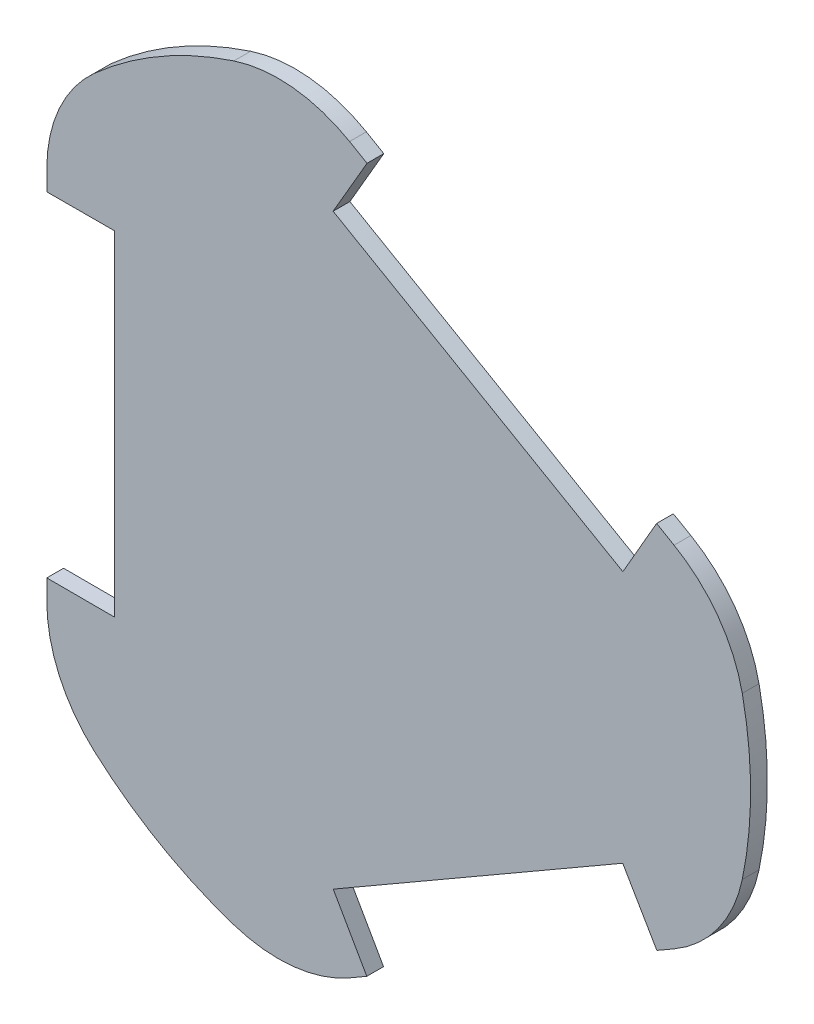
from build123d import *

# Parameters (mm, degrees)
SKETCH1_R           = 5
BOSS_EXTRUDE1_DEPTH = 2
SKETCH2_R           = 6
BOSS_EXTRUDE2_DEPTH = 2
SKETCH4_R           = 4
BOSS_EXTRUDE3_DEPTH = 1


with BuildPart() as part:
    # Sketch1 → Boss-Extrude1 (new body)
    with BuildSketch(Plane.XY):
        with BuildLine():
            Line((26.754759572, 15.066584336), (-7.828159274, 35.03304384))
            Line((-7.828159274, 35.03304384), (-3.776725793, 42.017662227))
            Line((-3.776725793, 42.017662227), (-5.864916731, 43.223279828))
            ThreePointArc((-5.864916731, 43.223279828), (-10.564626295, 45.070633496), (-15.599655414, 45.455948092))
            ThreePointArc((-15.599655414, 45.455948092), (-17.660328687, 45.178385552), (-19.671702879, 44.651328476))
            ThreePointArc((-19.671702879, 44.651328476), (-28.5, 40.703193978), (-36.333333333, 35.031731647))
            ThreePointArc((-36.333333333, 35.031731647), (-37.795465247, 33.553359039), (-39.066178094, 31.907544906))
            ThreePointArc((-39.066178094, 31.907544906), (-41.250000425, 27.354424482), (-42, 22.360679775))
            Line((-42, 22.360679775), (-42, 19.950798463))
            Line((-42, 19.950798463), (-33.9254247, 19.967136312))
            Line((-33.9254247, 19.967136312), (-33.9254247, -19.965779701))
            Line((-33.9254247, -19.965779701), (-42, -19.949444575))
            Line((-42, -19.949444575), (-42, -22.360679775))
            ThreePointArc((-42, -22.360679775), (-41.250000425, -27.354424482), (-39.066178094, -31.907544906))
            ThreePointArc((-39.066178094, -31.907544906), (-37.795465247, -33.553359039), (-36.333333333, -35.031731647))
            ThreePointArc((-36.333333333, -35.031731647), (-28.5, -40.703193978), (-19.671702879, -44.651328476))
            ThreePointArc((-19.671702879, -44.651328476), (-17.660328687, -45.178385552), (-15.599655414, -45.455948092))
            ThreePointArc((-15.599655414, -45.455948092), (-10.564626295, -45.070633496), (-5.864916731, -43.223279828))
            Line((-5.864916731, -43.223279828), (-3.808380011, -42.035937798))
            Line((-3.808380011, -42.035937798), (-7.811356047, -35.023340495))
            Line((-7.811356047, -35.023340495), (26.735608761, -15.07764306))
            Line((26.735608761, -15.07764306), (30.807203868, -22.050621128))
            Line((30.807203868, -22.050621128), (32.864916731, -20.862600053))
            ThreePointArc((32.864916731, -20.862600053), (36.81462672, -17.716209014), (39.665833508, -13.548403186))
            ThreePointArc((39.665833508, -13.548403186), (40.455793934, -11.625026513), (41.005036212, -9.619596828))
            ThreePointArc((41.005036212, -9.619596828), (42, 0), (41.005036212, 9.619596828))
            ThreePointArc((41.005036212, 9.619596828), (40.455793934, 11.625026513), (39.665833508, 13.548403186))
            ThreePointArc((39.665833508, 13.548403186), (36.81462672, 17.716209014), (32.864916731, 20.862600053))
            Line((32.864916731, 20.862600053), (30.777898295, 22.067540709))
            Line((30.777898295, 22.067540709), (26.754759572, 15.066584336))
        make_face()
        with Locations((-25, 34.641016151)):
            Circle(SKETCH1_R, mode=Mode.SUBTRACT)
        with Locations((35, 0)):
            Circle(SKETCH1_R, mode=Mode.SUBTRACT)
        with Locations((-25, -34.641016151)):
            Circle(SKETCH1_R, mode=Mode.SUBTRACT)
    extrude(amount=BOSS_EXTRUDE1_DEPTH)

    # Sketch2 → Boss-Extrude2 (add)
    with BuildSketch(Plane.XY.offset(2)):
        with Locations((-25, 34.641016151)):
            Circle(SKETCH2_R)
        with Locations((-25, -34.641016151)):
            Circle(SKETCH2_R)
        with Locations((35, 0)):
            Circle(SKETCH2_R)
    extrude(amount=-BOSS_EXTRUDE2_DEPTH)

    # Sketch4 → Boss-Extrude3 (add)
    with BuildSketch(Plane(origin=(0, 0, 0), x_dir=(-1, 0, 0), z_dir=(0, 0, -1))):
        with Locations((25, 34.641016151)):
            Circle(SKETCH4_R)
        with Locations((-35, 0)):
            Circle(SKETCH4_R)
        with Locations((25, -34.641016151)):
            Circle(SKETCH4_R)
    extrude(amount=BOSS_EXTRUDE3_DEPTH)


solid = part.part
